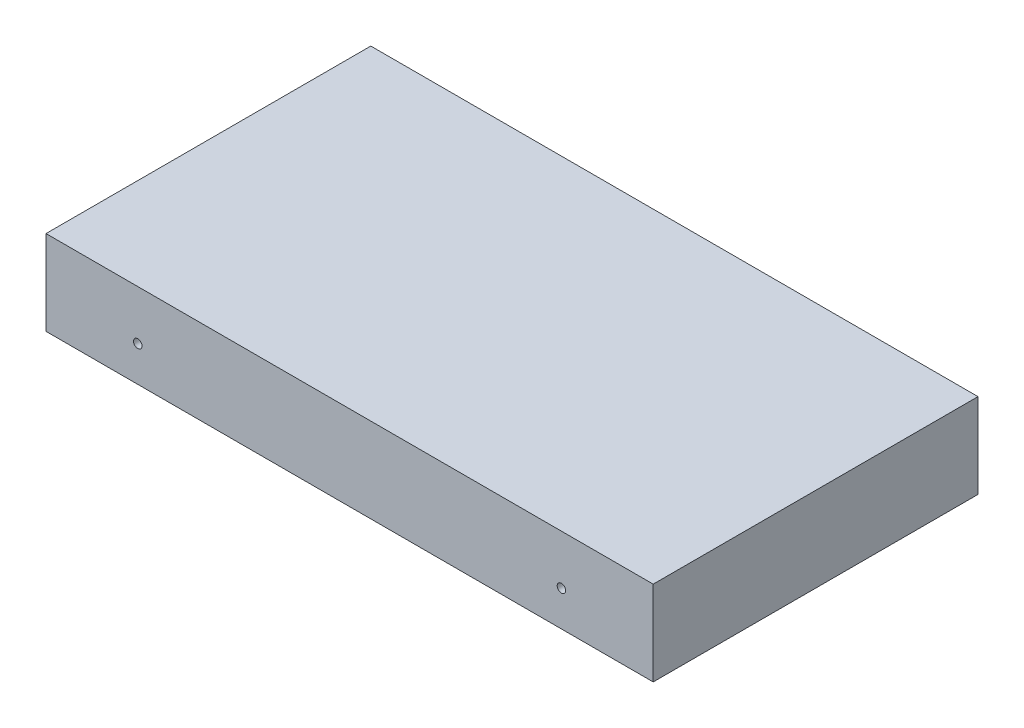
from build123d import *

# Parameters (mm, degrees)
SKETCH1_W                         = 215
SKETCH1_H                         = 115
BOSS_EXTRUDE1_DEPTH               = 30
F_3_0_3_DIAMETER_HOLE1_AT_2_COUNT = 2
F_3_0_3_DIAMETER_HOLE1_AT_2_PITCH = 150


with BuildPart() as part:
    # Sketch1 → Boss-Extrude1 (new body)
    with BuildSketch(Plane(origin=(0, 0, 0), x_dir=(1, 0, 0), z_dir=(0, 1, 0))):
        Rectangle(SKETCH1_W, SKETCH1_H)
    extrude(amount=BOSS_EXTRUDE1_DEPTH)

    # Sketch3 → Ø3.0 (3) Diameter Hole1 (revolve, cut)
    with BuildSketch(Plane(origin=(-75, 12.5, 57.5), x_dir=(0, -1, 0), z_dir=(1, 0, 0))):
        Polygon((0, 0), (0, 8.013290929), (1.5, 7.112), (1.5, 0), align=None)
    f_3_0_3_diameter_hole1 = revolve(axis=Axis((-75, 12.5, 63.85), (0, 0, -1)), mode=Mode.SUBTRACT)

    # Ø3.0 (3) Diameter Hole1 at 2: Ø3.0 (3) Diameter Hole1 ×2
    with Locations(*[(i * F_3_0_3_DIAMETER_HOLE1_AT_2_PITCH, 0, 0) for i in range(1, F_3_0_3_DIAMETER_HOLE1_AT_2_COUNT)]):
        add(f_3_0_3_diameter_hole1, mode=Mode.SUBTRACT)

    # Mirror1: Ø3.0 (3) Diameter Hole1 across plane
    add(f_3_0_3_diameter_hole1.mirror(Plane.XY), mode=Mode.SUBTRACT)

    # Mirror1 copy 1 sketch → Mirror1 copy 1 (revolve, cut)
    with BuildSketch(Plane(origin=(75, 12.5, -57.5), x_dir=(0, -1, 0), z_dir=(1, 0, 0))):
        Polygon((0, 0), (0, -8.013290929), (1.5, -7.112), (1.5, 0), align=None)
    revolve(axis=Axis((75, 12.5, -63.85), (0, 0, -1)), mode=Mode.SUBTRACT)


solid = part.part
